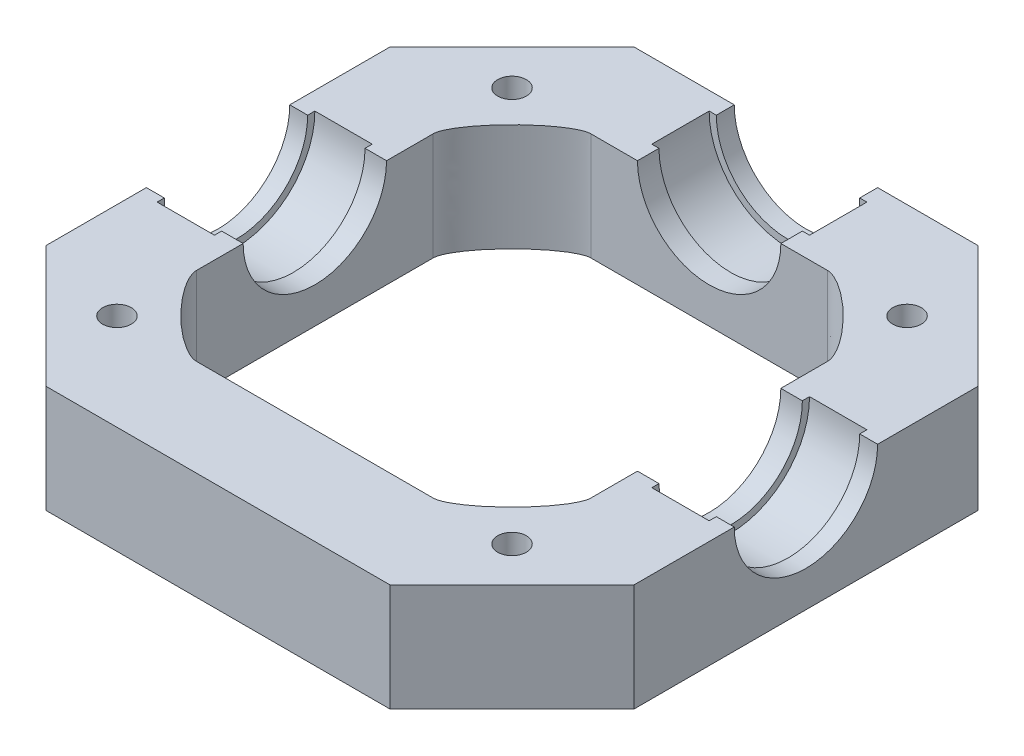
from build123d import *

# Parameters (mm, degrees)
SKETCH1_W           = 82
SKETCH1_H           = 82
SKETCH1_W_2         = 55
SKETCH1_H_2         = 55
BOSS_EXTRUDE1_DEPTH = 15
SKETCH2_R           = 10
CUT_EXTRUDE1_DEPTH  = 60.891568689
CUT_EXTRUDE2_START  = -30.5
SKETCH3_R           = 11
CUT_EXTRUDE2_DEPTH  = 8
CIRPATTERN3_COUNT   = 3
CIRPATTERN3_ANGLE   = 180
FILLET1_SIZE        = 11
CHAMFER1_SIZE       = 17
CUT_EXTRUDE3_START  = -7
CUT_EXTRUDE3_DEPTH  = 4
SKETCH5_R           = 2
CUT_EXTRUDE4_DEPTH  = 59.83876289
CIRPATTERN4_COUNT   = 4


with BuildPart() as part:
    # Sketch1 → Boss-Extrude1 (new body)
    with BuildSketch(Plane(origin=(0, 0, 0), x_dir=(1, 0, 0), z_dir=(0, 1, 0))):
        Rectangle(SKETCH1_W, SKETCH1_H)
        Rectangle(SKETCH1_W_2, SKETCH1_H_2, mode=Mode.SUBTRACT)
    extrude(amount=-BOSS_EXTRUDE1_DEPTH)

    # Sketch2 → Cut-Extrude1 (cut, through all)
    with BuildSketch(Plane(origin=(0, 0, 0), x_dir=(0, 0, -1), z_dir=(1, 0, 0))):
        Circle(SKETCH2_R)
    cut_extrude1 = extrude(amount=-CUT_EXTRUDE1_DEPTH, mode=Mode.SUBTRACT)

    # Sketch3 → Cut-Extrude2 (cut)
    with BuildSketch(Plane(origin=(0, 0, 0), x_dir=(0, 0, -1), z_dir=(1, 0, 0)).offset(CUT_EXTRUDE2_START)):
        Circle(SKETCH3_R)
    cut_extrude2 = extrude(amount=-CUT_EXTRUDE2_DEPTH, mode=Mode.SUBTRACT)

    # CirPattern3: Cut-Extrude1, Cut-Extrude2 ×3 about axis
    cirpattern3_axis = Axis((0, 0, 0), (0, -1, 0))
    add([cut_extrude1.rotate(cirpattern3_axis, i * CIRPATTERN3_ANGLE / (CIRPATTERN3_COUNT - 1)) for i in range(1, CIRPATTERN3_COUNT)], mode=Mode.SUBTRACT)
    add([cut_extrude2.rotate(cirpattern3_axis, i * CIRPATTERN3_ANGLE / (CIRPATTERN3_COUNT - 1)) for i in range(1, CIRPATTERN3_COUNT)], mode=Mode.SUBTRACT)

    # Fillet1
    # a fillet whose section is not a circle: 11 mm, written as the material it adds along each edge
    with BuildSketch(Plane(origin=(-27.5, 0, 27.5), x_dir=(0, 0, -1), z_dir=(0, -1, 0))) as fillet1_piece_1:
        with BuildLine():
            Bezier((FILLET1_SIZE, 0), (0, 0), (0, FILLET1_SIZE), weights=[1, 0.25, 1])
            Line((0, FILLET1_SIZE), (0, 0))
            Line((0, 0), (FILLET1_SIZE, 0))
        make_face()
    extrude(amount=15)
    with BuildSketch(Plane(origin=(-27.5, 0, -27.5), x_dir=(0, 0, 1), z_dir=(0, -1, 0)), Plane(origin=(27.5, 0, 27.5), x_dir=(0, 0, -1), z_dir=(0, -1, 0)), Plane(origin=(27.5, 0, -27.5), x_dir=(-1, 0, 0), z_dir=(0, -1, 0))) as fillet1_piece_2:
        with BuildLine():
            Bezier((FILLET1_SIZE, 0), (0, 0), (0, -FILLET1_SIZE), weights=[1, 0.25, 1])
            Line((0, -FILLET1_SIZE), (0, 0))
            Line((0, 0), (FILLET1_SIZE, 0))
        make_face()
    extrude(amount=15)

    # Chamfer1
    chamfer1_edges = [part.edges().sort_by_distance(p)[0] for p in [
        (41, -7.5, 41),
        (-41, -7.5, 41),
        (-41, -7.5, -41),
        (41, -7.5, -41),
    ]]
    chamfer(chamfer1_edges, length=CHAMFER1_SIZE)

    # Sketch4 → Cut-Extrude3 (cut, symmetric)
    with BuildSketch(Plane(origin=(32.5, 0, -32.5), x_dir=(-0.7071067811865488, 0, -0.7071067811865464), z_dir=(0.7071067811865464, 0, -0.7071067811865488)).offset(CUT_EXTRUDE3_START)):
        Polygon((-2, -10), (2, -10), (2, -11), (4, -11), (8, -15), (-8, -15), (-4, -11), (-2, -11), align=None)
    cut_extrude3 = extrude(amount=CUT_EXTRUDE3_DEPTH, both=True, mode=Mode.SUBTRACT)

    # Sketch5 → Cut-Extrude4 (cut, through all)
    with BuildSketch(Plane.XZ.offset(10)):
        with Locations(Location((27.550252532, -27.550252532, 0), (0, 0, 225))):
            Circle(SKETCH5_R)
    cut_extrude4 = extrude(amount=-CUT_EXTRUDE4_DEPTH, mode=Mode.SUBTRACT)

    # CirPattern4: Cut-Extrude3, Cut-Extrude4 ×4 about axis
    cirpattern4_axis = Axis((0, 0, 0), (0, 1, 0))
    add([cut_extrude3.rotate(cirpattern4_axis, i * 360 / CIRPATTERN4_COUNT) for i in range(1, CIRPATTERN4_COUNT)], mode=Mode.SUBTRACT)
    add([cut_extrude4.rotate(cirpattern4_axis, i * 360 / CIRPATTERN4_COUNT) for i in range(1, CIRPATTERN4_COUNT)], mode=Mode.SUBTRACT)


solid = part.part
